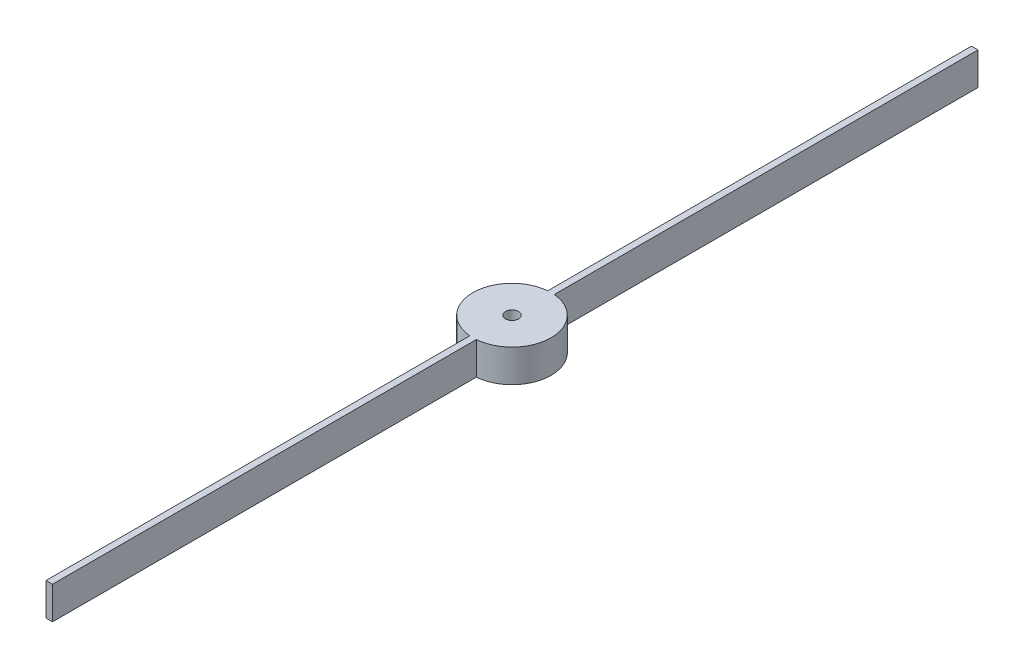
from build123d import *

# Parameters (mm, degrees)
SKETCH1_R           = 2
BOSS_EXTRUDE1_DEPTH = 10


with BuildPart() as part:
    # Sketch1 → Boss-Extrude1 (new body)
    with BuildSketch(Plane(origin=(0, 0, 0), x_dir=(1, 0, 0), z_dir=(0, 1, 0))):
        with BuildLine():
            Line((-1, 11.958260743), (-1, 141.958260743))
            Line((-1, 141.958260743), (1, 141.958260743))
            Line((1, 141.958260743), (1, 11.958260743))
            ThreePointArc((1, 11.958260743), (12, 0), (1, -11.958260743))
            Line((1, -11.958260743), (1, -141.958260743))
            Line((1, -141.958260743), (-1, -141.958260743))
            Line((-1, -141.958260743), (-1, -11.958260743))
            ThreePointArc((-1, -11.958260743), (-12, 0), (-1, 11.958260743))
        make_face()
        Circle(SKETCH1_R, mode=Mode.SUBTRACT)
    extrude(amount=BOSS_EXTRUDE1_DEPTH)


solid = part.part
